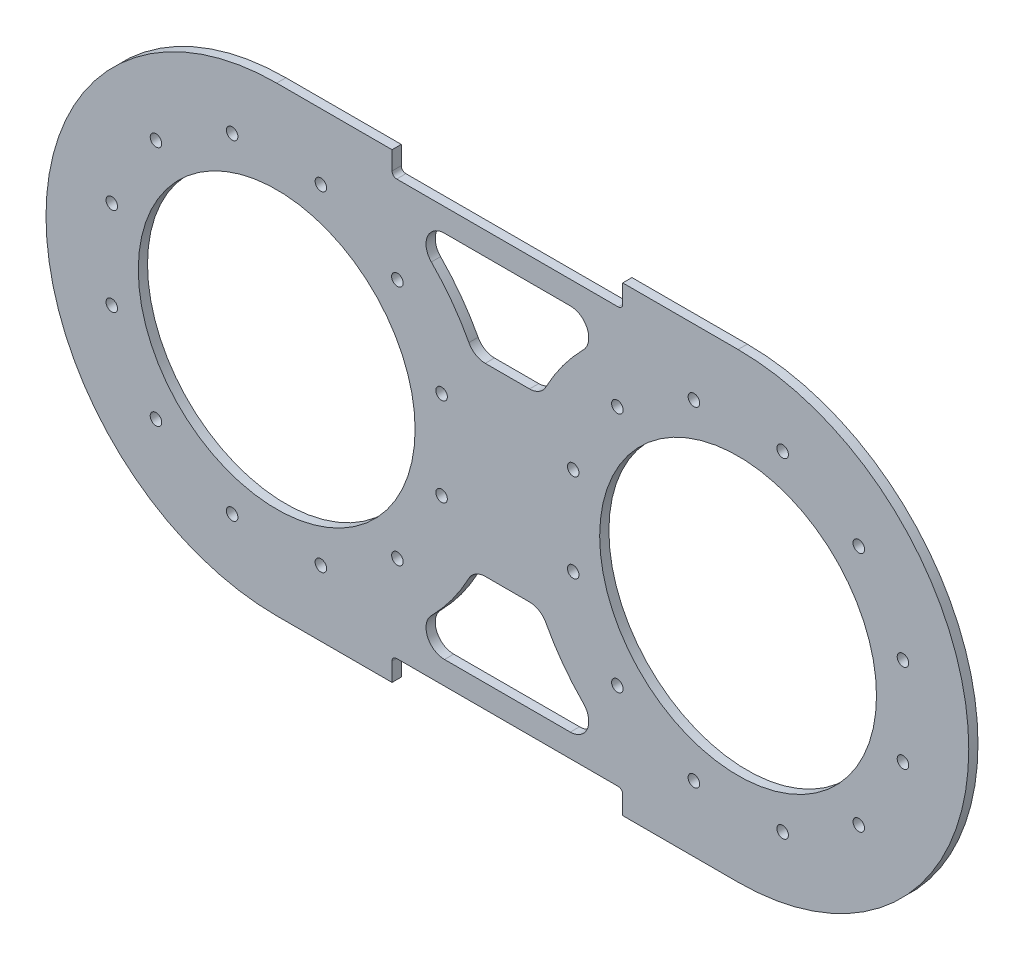
from build123d import *

# Parameters (mm, degrees)
SKETCH_1_R         = 30
EXTRUDE_1_DEPTH    = 2
HOLE_WIZARD_M3_1_D = 2.5
FILLET_1_R         = 4
FILLET_2_R         = 1


with BuildPart() as part:
    # 草图1 → 凸台-拉伸1 (new body)
    with BuildSketch(Plane.XY):
        with BuildLine():
            Line((-25, 45), (25, 45))
            Line((25, 45), (25, 50))
            Line((25, 50), (50, 50))
            ThreePointArc((50, 50), (100, 0), (50, -50))
            Line((50, -50), (25, -50))
            Line((25, -50), (25, -45))
            Line((25, -45), (-25, -45))
            Line((-25, -45), (-25, -50))
            Line((-25, -50), (-50, -50))
            ThreePointArc((-50, -50), (-100, 0), (-50, 50))
            Line((-50, 50), (-25, 50))
            Line((-25, 50), (-25, 45))
        make_face()
        with Locations((-50, 0)):
            Circle(SKETCH_1_R, mode=Mode.SUBTRACT)
        with Locations((50, 0)):
            Circle(SKETCH_1_R, mode=Mode.SUBTRACT)
        with BuildLine():
            Line((-7.279981273, -20), (7.279981273, -20))
            ThreePointArc((7.279981273, -20), (14.694189797, -31.280980898), (25, -40))
            Line((25, -40), (-25, -40))
            ThreePointArc((-25, -40), (-14.694189797, -31.280980898), (-7.279981273, -20))
        make_face(mode=Mode.SUBTRACT)
        with BuildLine():
            Line((25, 40), (-25, 40))
            ThreePointArc((-25, 40), (-14.694189797, 31.280980898), (-7.279981273, 20))
            Line((-7.279981273, 20), (7.279981273, 20))
            ThreePointArc((7.279981273, 20), (14.694189797, 31.280980898), (25, 40))
        make_face(mode=Mode.SUBTRACT)
    extrude(amount=EXTRUDE_1_DEPTH)

    # M3 螺纹孔的螺纹孔钻头1 (through all)
    with Locations(Plane(origin=(-40.423695331, 35.739255573, 2), x_dir=(1, 0, 0), z_dir=(0, 0, 1))):
        with Locations((0, 0), (16.586646235, -9.576304669), (26.162950904, -26.162950904), (-19.23309471, -0.021663184), (-35.739255573, -9.576304669), (-45.315560242, -26.162950904), (126.162950904, -26.162950904), (116.586646235, -9.576304669), (100.080485372, -0.021663184), (54.684439758, -26.162950904), (64.260744427, -9.576304669), (80.847390662, 0), (80.847390662, -71.478511146), (64.260744427, -61.902206477), (54.684439758, -45.315560242), (100.080485372, -71.456847962), (116.586646235, -61.902206477), (126.162950904, -45.315560242), (-45.315560242, -45.315560242), (-35.739255573, -61.902206477), (-19.23309471, -71.456847962), (26.162950904, -45.315560242), (16.586646235, -61.902206477), (0, -71.478511146)):
            Hole(HOLE_WIZARD_M3_1_D / 2)

    # 圆角1
    fillet_1_edges = [part.edges().sort_by_distance(p)[0] for p in [
        (7.279981273, 20, 1),
        (-7.279981273, 20, 1),
        (25, 40, 1),
        (-25, 40, 1),
        (-7.279981273, -20, 1),
        (7.279981273, -20, 1),
        (25, -40, 1),
        (-25, -40, 1),
    ]]
    fillet(fillet_1_edges, radius=FILLET_1_R)

    # 圆角2
    fillet_2_edges = [part.edges().sort_by_distance(p)[0] for p in [
        (25, 45, 1),
        (-25, 45, 1),
        (25, -45, 1),
        (-25, -45, 1),
    ]]
    fillet(fillet_2_edges, radius=FILLET_2_R)


solid = part.part
